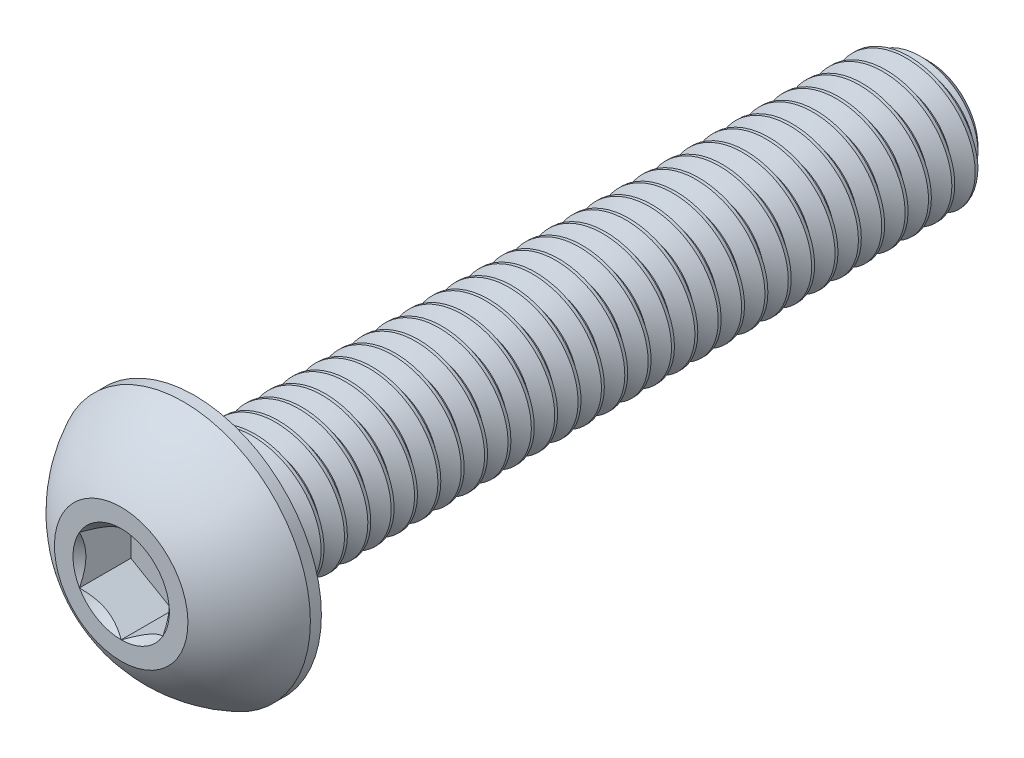
from build123d import *

# Parameters (mm, degrees)
CUT_EXTRUDE2_DEPTH = 1.54
CUT_SWEEP2_PITCH   = 0.7
CUT_SWEEP2_TO      = 22


with BuildPart() as part:
    # Sketch10 → Revolve3 (revolve)
    with BuildSketch(Plane(origin=(0, 0, 0), x_dir=(0, 0, -1), z_dir=(1, 0, 0)), mode=Mode.PRIVATE) as revolve3_sk:
        Polygon((23.675, 2), (24.2, 1.475), (24.2, 0), (2.2, 0), (2.2, 2), align=None)
    revolve(revolve3_sk.sketch.rotate(Axis((0, 0, 0), (0, 0, -1)), 90), axis=Axis((0, 0, 0), (0, 0, -1)))

    # Sketch7 → Revolve2 (revolve)
    with BuildSketch(Plane(origin=(0, 0, 0), x_dir=(0, 0, -1), z_dir=(1, 0, 0)), mode=Mode.PRIVATE) as revolve2_sk:
        with BuildLine():
            Line((1.87, 3.8), (2.2, 3.8))
            Line((2.2, 3.8), (2.2, 0))
            Line((2.2, 0), (0, 0))
            Line((0, 0), (0, 2))
            ThreePointArc((0, 2), (0.793500147, 3.047002626), (1.87, 3.8))
        make_face()
    revolve(revolve2_sk.sketch.rotate(Axis((0, 0, 0), (0, 0, -1)), 180), axis=Axis((0, 0, 0), (0, 0, -1)))

    # Sketch5 → Cut-Extrude2 (cut)
    with BuildSketch(Plane.XY):
        Polygon((1.25, -0.721687836), (1.25, 0.721687836), (0, 1.443375673), (-1.25, 0.721687836), (-1.25, -0.721687836), (0, -1.443375673), align=None)
    extrude(amount=-CUT_EXTRUDE2_DEPTH, mode=Mode.SUBTRACT)

    # Cut-Extrude3 cone 1 section (through the dimple's axis) → Cut-Extrude3 (revolve, cut)
    with BuildSketch(Plane(origin=(0, 0, 0), x_dir=(0, -1, 0), z_dir=(1, 0, 0))):
        Polygon((0, 0), (1.443375673, 0), (0, 1.443375673), align=None)
    revolve(axis=Axis((0, 0, 0), (0, 0, -1)), mode=Mode.SUBTRACT)


with BuildPart() as body_2:
    # Split1: read off the stored shape, not the designer's step
    # Split1: the piece on the far side of the plane
    add(part.part)
    split(bisect_by=Plane.XY.offset(-2.2), keep=Keep.BOTTOM)

    # Cut-Sweep2: arcs per turn and ends read off the stored shape
    # Cut-Sweep2: the profile of Sketch12 screwed along a right-hand helix through 35.666667 turns, 6 arcs to a turn; built about Z, then put on its axis
    cut_sweep2_z = Axis((0, 0, 0), (0, 0, 1))
    cut_sweep2_corners = [(1.545336663, 0, -0.2625), (1.545336663, 0, -0.35), (2.037888611, 0, -0.634375), (2.037888611, 0, 0.021875)]
    with BuildLine(mode=Mode.PRIVATE) as cut_sweep2_profile:
        Line(cut_sweep2_corners[0], cut_sweep2_corners[1])
        Line(cut_sweep2_corners[1], cut_sweep2_corners[2])
        Line(cut_sweep2_corners[2], cut_sweep2_corners[3])
        Line(cut_sweep2_corners[3], cut_sweep2_corners[0])
    cut_sweep2_cap = Face(cut_sweep2_profile.wire())
    cut_sweep2_turn_angles = [0, 30, 60, 90, 120, 150, 180, 210, 240, 270, 300, 330, 360]
    cut_sweep2_turn_weights = [1, 0.8660254037844387, 1, 0.8660254037844387, 1, 0.8660254037844387, 1, 0.8660254037844387, 1, 0.8660254037844387, 1, 0.8660254037844387, 1]
    cut_sweep2_turn_rails = [Edge.make_bspline([Vector(p[0], p[1], 0).rotate(cut_sweep2_z, cut_sweep2_turn_angles[k]) / cut_sweep2_turn_weights[k] + Vector(0, 0, p[2] + CUT_SWEEP2_PITCH * cut_sweep2_turn_angles[k] / 360) for k in range(13)], [0, 0, 0, 1, 1, 2, 2, 3, 3, 4, 4, 5, 5, 6, 6, 6], 2, cut_sweep2_turn_weights) for p in cut_sweep2_corners]
    cut_sweep2_turn_sides = [Face.make_surface_from_curves(cut_sweep2_turn_rails[p[0]], cut_sweep2_turn_rails[p[1]]) for p in [(0, 1), (1, 2), (2, 3), (3, 0)]]
    cut_sweep2_last_angles = [12600, 12630, 12660, 12690, 12720, 12750, 12780, 12810, 12840]
    cut_sweep2_last_weights = [1, 0.8660254037844387, 1, 0.8660254037844387, 1, 0.8660254037844387, 1, 0.8660254037844387, 1]
    cut_sweep2_last_rails = [Edge.make_bspline([Vector(p[0], p[1], 0).rotate(cut_sweep2_z, cut_sweep2_last_angles[k]) / cut_sweep2_last_weights[k] + Vector(0, 0, p[2] + CUT_SWEEP2_PITCH * cut_sweep2_last_angles[k] / 360) for k in range(9)], [0, 0, 0, 1, 1, 2, 2, 3, 3, 4, 4, 4], 2, cut_sweep2_last_weights) for p in cut_sweep2_corners]
    cut_sweep2_last_sides = [Face.make_surface_from_curves(cut_sweep2_last_rails[p[0]], cut_sweep2_last_rails[p[1]]) for p in [(0, 1), (1, 2), (2, 3), (3, 0)]]
    cut_sweep2 = Plane(origin=(0, 0, -24.2), x_dir=(0, 1, 0), z_dir=(0, 0, 1)) * split(Solid(Shell([*[p.moved(Location((0, 0, CUT_SWEEP2_PITCH * i))) for i in range(35) for p in cut_sweep2_turn_sides], *cut_sweep2_last_sides, cut_sweep2_cap, cut_sweep2_cap.rotate(cut_sweep2_z, 12840).moved(Location((0, 0, CUT_SWEEP2_PITCH * 12840 / 360)))])), bisect_by=Plane.XY.offset(CUT_SWEEP2_TO), keep=Keep.BOTTOM, mode=Mode.PRIVATE)
    add(cut_sweep2, mode=Mode.SUBTRACT)


with BuildPart() as part_1:
    add(part.part)

    # Split1
    split(bisect_by=Plane.XY.offset(-2.2), keep=Keep.TOP)

    add(body_2.part)  # Boss-Extrude1 merges body 2
    # Boss-Extrude1 cone 1 section (through the dimple's axis) → Boss-Extrude1 (revolve)
    with BuildSketch(Plane(origin=(0, 0, -2.2), x_dir=(0, -1, 0), z_dir=(1, 0, 0))):
        Polygon((0, 0), (2, 0), (0, 2), align=None)
    revolve(axis=Axis((0, 0, -2.2), (0, 0, -1)))


solid = part_1.part
